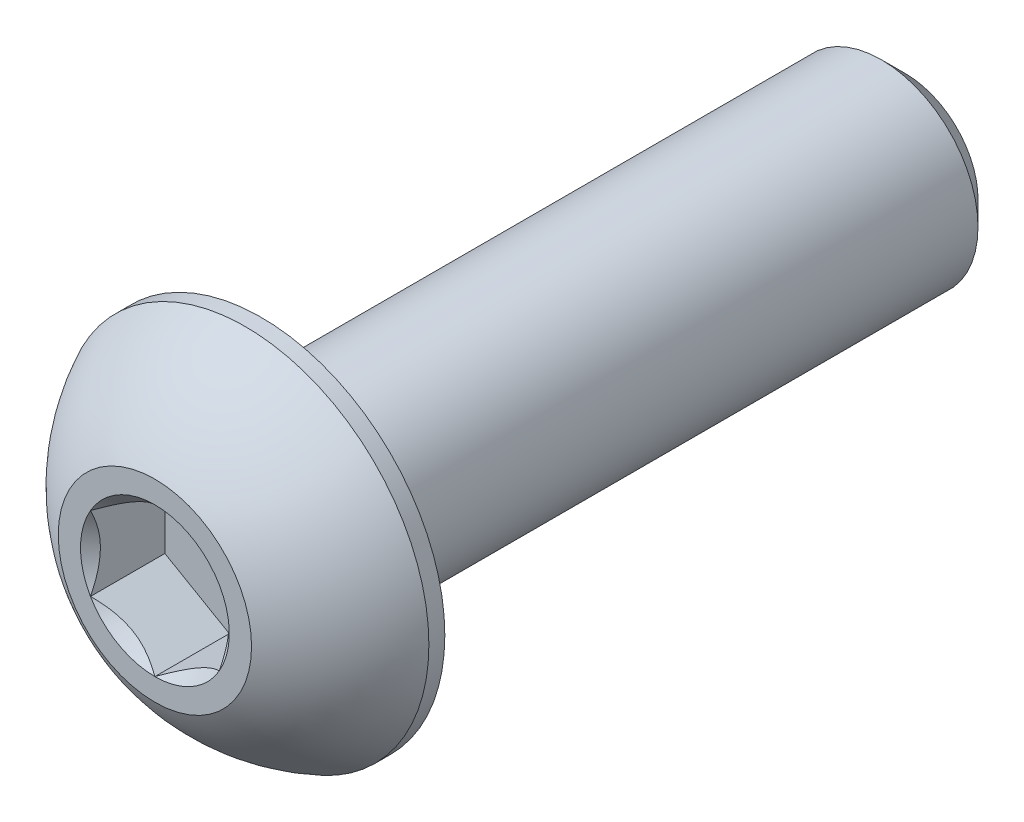
from build123d import *

# Parameters (mm, degrees)
SKETCH1_W          = 10
SKETCH1_H          = 1.5
CHAMFER1_SIZE      = 0.375
CUT_EXTRUDE2_DEPTH = 1.155


with BuildPart() as part:
    # Sketch1 → Revolve1 (revolve)
    with BuildSketch(Plane(origin=(0, 0, 0), x_dir=(0, 0, -1), z_dir=(1, 0, 0))):
        with Locations((6.65, 0.75)):
            Rectangle(SKETCH1_W, SKETCH1_H)
    revolve(axis=Axis((0, 0, -11.65), (0, 0, 1)))

    # Chamfer1
    chamfer1_edges = [part.edges().sort_by_distance(p)[0] for p in [
        (0, -1.5, -11.65),
    ]]
    chamfer(chamfer1_edges, length=CHAMFER1_SIZE)

    # Sketch7 → Revolve2 (revolve)
    with BuildSketch(Plane(origin=(0, 0, 0), x_dir=(0, 0, -1), z_dir=(1, 0, 0))):
        with BuildLine():
            Line((1.4025, 2.85), (1.65, 2.85))
            Line((1.65, 2.85), (1.65, 0))
            Line((1.65, 0), (0, 0))
            Line((0, 0), (0, 1.5))
            ThreePointArc((0, 1.5), (0.59512511, 2.285251969), (1.4025, 2.85))
        make_face()
    revolve(axis=Axis((0, 0, 0), (0, 0, -1)))

    # Sketch5 → Cut-Extrude2 (cut)
    with BuildSketch(Plane.XY):
        Polygon((1, -0.577350269), (1, 0.577350269), (0, 1.154700538), (-1, 0.577350269), (-1, -0.577350269), (0, -1.154700538), align=None)
    extrude(amount=-CUT_EXTRUDE2_DEPTH, mode=Mode.SUBTRACT)

    # Cut-Extrude3 cone 1 section (through the dimple's axis) → Cut-Extrude3 (revolve, cut)
    with BuildSketch(Plane(origin=(0, 0, 0), x_dir=(0, -1, 0), z_dir=(1, 0, 0))):
        Polygon((0, 0), (1.154700538, 0), (0, 1.154700538), align=None)
    revolve(axis=Axis((0, 0, 0), (0, 0, -1)), mode=Mode.SUBTRACT)


solid = part.part
